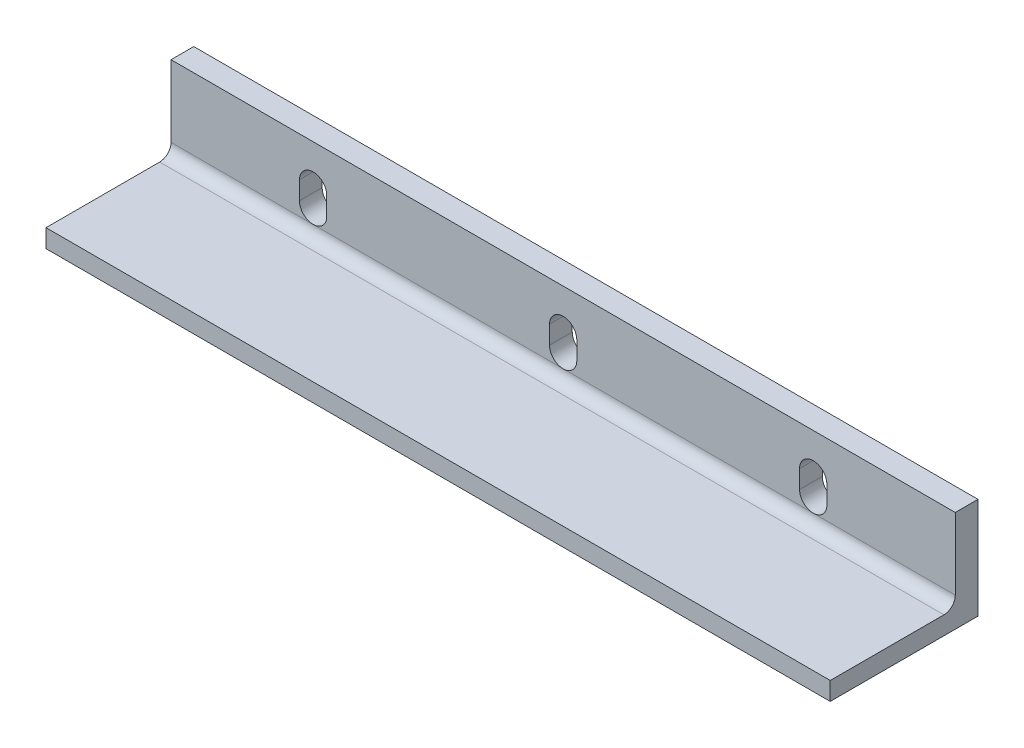
from build123d import *

# Parameters (mm, degrees)
SKETCH1_W                = 69
SKETCH1_H                = 13
BOSS_EXTRUDE1_DEPTH      = 1.6
SKETCH2_W                = 69
SKETCH2_H                = 2
BOSS_EXTRUDE2_DEPTH      = 7.3
FILLET1_R                = 1
M2_START                 = -6.5
M2_CLEARANCE_SLOT1_DEPTH = 2


# Read off the part's stored shape, not the designer's step: M2 Clearance Slot1
with BuildPart() as part:
    # Sketch1 → Boss-Extrude1 (new body)
    with BuildSketch(Plane(origin=(0, 0, 0), x_dir=(1, 0, 0), z_dir=(0, 1, 0))):
        Rectangle(SKETCH1_W, SKETCH1_H)
    extrude(amount=BOSS_EXTRUDE1_DEPTH)

    # Sketch2 → Boss-Extrude2 (add)
    with BuildSketch(Plane(origin=(0, 1.6, 0), x_dir=(1, 0, 0), z_dir=(0, 1, 0))):
        with Locations((0, 5.5)):
            Rectangle(SKETCH2_W, SKETCH2_H)
    extrude(amount=BOSS_EXTRUDE2_DEPTH)

    # Fillet1
    fillet1_edges = [part.edges().sort_by_distance(p)[0] for p in [
        (0, 1.6, -4.5),
    ]]
    fillet(fillet1_edges, radius=FILLET1_R)

    # M2 Clearance Slot1 outline → M2 Clearance Slot1 (cut)
    with BuildSketch(Plane.XY.offset(M2_START)):
        with BuildLine():
            Line((23.2, 3.8), (23.2, 5.4))
            ThreePointArc((23.2, 5.4), (22, 6.6), (20.8, 5.4))
            Line((20.8, 5.4), (20.8, 3.8))
            ThreePointArc((20.8, 3.8), (22, 2.6), (23.2, 3.8))
        make_face()
        with BuildLine():
            Line((1.2, 3.8), (1.2, 5.4))
            ThreePointArc((1.2, 5.4), (0, 6.6), (-1.2, 5.4))
            Line((-1.2, 5.4), (-1.2, 3.8))
            ThreePointArc((-1.2, 3.8), (0, 2.6), (1.2, 3.8))
        make_face()
        with BuildLine():
            Line((-20.8, 3.8), (-20.8, 5.4))
            ThreePointArc((-20.8, 5.4), (-22, 6.6), (-23.2, 5.4))
            Line((-23.2, 5.4), (-23.2, 3.8))
            ThreePointArc((-23.2, 3.8), (-22, 2.6), (-20.8, 3.8))
        make_face()
    extrude(amount=M2_CLEARANCE_SLOT1_DEPTH, mode=Mode.SUBTRACT)


solid = part.part
